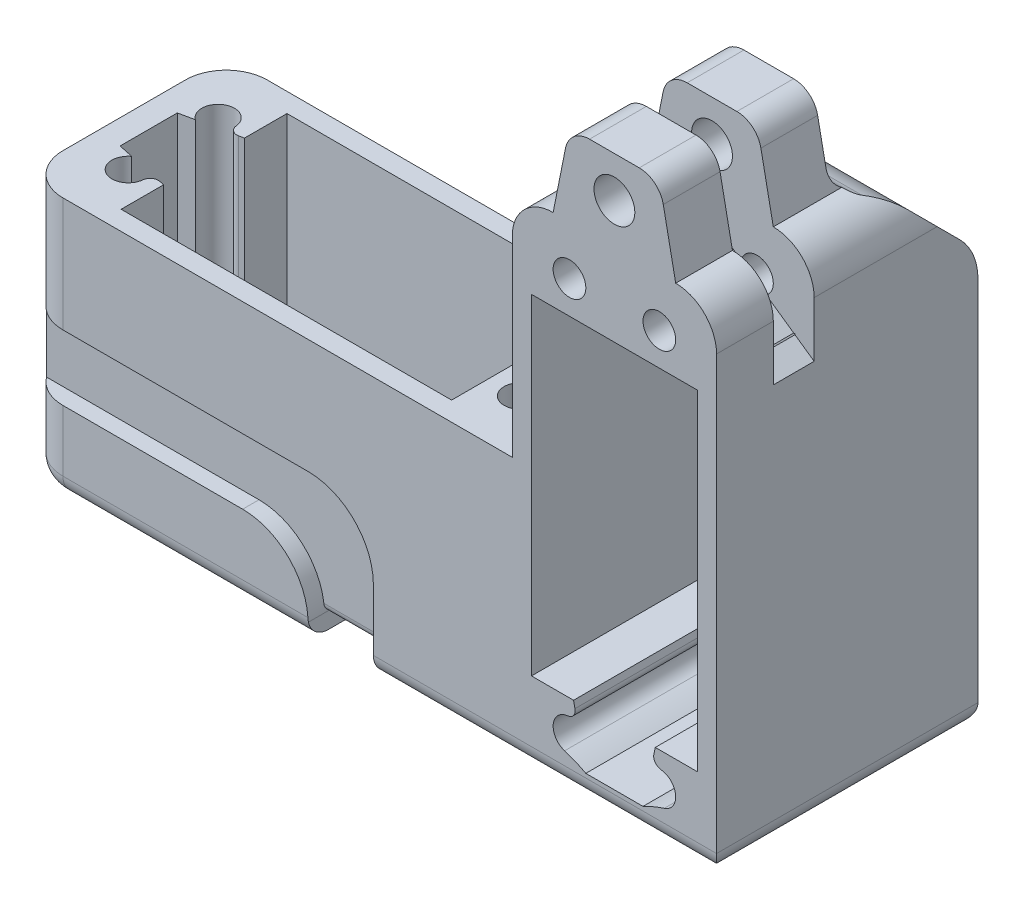
from build123d import *

# Parameters (mm, degrees)
CROQUIS3_R                 = 2.000000000000003
SALIENTE_EXTRUIR1_DEPTH    = 28
SALIENTE_EXTRUIR2_START    = -4
SALIENTE_EXTRUIR2_DEPTH    = 4
CORTAR_EXTRUIR1_DEPTH      = 23
REDONDEO12_R               = 1
CROQUIS5_W                 = 9.903571428571428
CROQUIS5_H                 = 4.000000000000001
CORTAR_EXTRUIR2_DEPTH      = 59.84556589072792
CROQUIS6_R                 = 8.125
CORTAR_EXTRUIR3_DEPTH      = 4
REDONDEO4_R                = 5
CROQUIS9_R                 = 2.000000000000001
CROQUIS9_R_2               = 2.0000000000000036
SALIENTE_EXTRUIR3_DEPTH    = 28
SALIENTE_EXTRUIR4_START    = -28
CROQUIS9_3_R               = 2.000000000000001
CROQUIS9_3_R_2             = 2.0000000000000036
SALIENTE_EXTRUIR4_DEPTH    = 4
CROQUIS10_R                = 8.124999999999998
CORTAR_EXTRUIR4_DEPTH      = 86.06234478310549
CORTAR_EXTRUIR5_DEPTH      = 23
REDONDEO10_R               = 15
REDONDEO11_R               = 1
CORTAR_EXTRUIR6_DEPTH      = 78.13917616879161
REDONDEO15_R               = 5
REDONDEO16_R               = 2.5
CORTAR_EXTRUIR7_DEPTH      = 2
CORTAR_EXTRUIR8_START      = 12.5
CORTAR_EXTRUIR8_DEPTH      = 2
REDONDEO17_R               = 1
REDONDEO18_R               = 8
REDONDEO19_R               = 2
CORTAR_EXTRUIR9_DEPTH      = 104.8838413994162
CORTAR_EXTRUIR9_DEPTH_BACK = 104.8838413994162
REDONDEO21_R               = 7.5
CROQUIS18_R                = 2.5000000000000027
SALIENTE_EXTRUIR5_DEPTH    = 18.893398
REDONDEO22_R               = 3
CORTAR_EXTRUIR10_DEPTH     = 2.5


# Some blends are built 0.0001 mm under size
with BuildPart() as part:
    # Croquis3 → Saliente-Extruir1 (new body)
    with BuildSketch(Plane(origin=(0, 0, 0), x_dir=(1, 0, 0), z_dir=(0, 1, 0))):
        with BuildLine():
            Line((-20.000000000000007, -12.499999999999998), (-25, -12.5))
            ThreePointArc((-25, -12.5), (-28.535533905932738, -11.035533905932738), (-30.000000000000007, -7.499999999999999))
            Line((-30.000000000000007, -7.499999999999999), (-30.000000000000007, 7.499999999999999))
            ThreePointArc((-30.000000000000007, 7.499999999999999), (-28.53553390593274, 11.035533905932741), (-25, 12.5))
            Line((-25, 12.5), (-20.000000000000004, 12.499999999999993))
            Line((-20.000000000000004, 12.499999999999993), (20.000000000000004, 12.499999999999993))
            Line((20.000000000000004, 12.499999999999993), (25, 12.5))
            Line((25, 12.5), (30.000000000000007, 12.499999999999998))
            Line((30.000000000000007, 12.499999999999998), (30.000000000000007, -12.499999999999998))
            Line((30.000000000000007, -12.499999999999998), (25, -12.5))
            Line((25, -12.5), (20.000000000000007, -12.499999999999998))
            Line((20.000000000000007, -12.499999999999998), (-20.000000000000007, -12.499999999999998))
        make_face()
        with Locations(Location((-24, 5.499999999999998, 0), (0, 0, 90))):
            Circle(CROQUIS3_R, mode=Mode.SUBTRACT)
        with Locations(Location((-24, -5.499999999999998, 0), (0, 0, 90))):
            Circle(CROQUIS3_R, mode=Mode.SUBTRACT)
        with Locations(Location((24, -5.499999999999998, 0), (0, 0, 90))):
            Circle(CROQUIS3_R, mode=Mode.SUBTRACT)
        with Locations(Location((24, 5.499999999999998, 0), (0, 0, 90))):
            Circle(CROQUIS3_R, mode=Mode.SUBTRACT)
        Polygon((-20.225, 10.149999999999999), (20.225, 10.149999999999999), (20.224999999999998, -10.149999999999999), (-20.224999999999998, -10.149999999999999), align=None, mode=Mode.SUBTRACT)
    extrude(amount=SALIENTE_EXTRUIR1_DEPTH)

    # Croquis3<2> → Saliente-Extruir2 (add)
    with BuildSketch(Plane(origin=(0, 0, 0), x_dir=(1, 0, 0), z_dir=(0, 1, 0)).offset(SALIENTE_EXTRUIR2_START)):
        with BuildLine():
            Line((-25, -12.5), (30.000000000000007, -12.499999999999998))
            Line((30.000000000000007, -12.499999999999998), (30.000000000000007, 12.499999999999998))
            Line((30.000000000000007, 12.499999999999998), (-25, 12.5))
            ThreePointArc((-25, 12.5), (-28.535533905932745, 11.03553390593274), (-30.000000000000007, 7.499999999999999))
            Line((-30.000000000000007, 7.499999999999999), (-30.000000000000007, -7.499999999999999))
            ThreePointArc((-30.000000000000007, -7.499999999999999), (-28.535533905932738, -11.035533905932738), (-25, -12.5))
        make_face()
    extrude(amount=SALIENTE_EXTRUIR2_DEPTH)

    # Croquis4 → Cortar-Extruir1 (cut)
    with BuildSketch(Plane(origin=(0, 27.999999999999915, 0), x_dir=(1, 0, 0), z_dir=(0, 1, 0))):
        Polygon((-20, 5), (-20, -5), (-27, -3.5), (-27, 3.5), align=None)
    extrude(amount=-CORTAR_EXTRUIR1_DEPTH, mode=Mode.SUBTRACT)

    # Redondeo12
    redondeo12_edges = [part.edges().sort_by_distance(p)[0] for p in [
        (-22.258829297566827, 16.499999999999936, 4.515965150521393),
        (-22.258829297566827, 16.499999999999936, -4.515965150521393),
    ]]
    fillet(redondeo12_edges, radius=REDONDEO12_R)

    # Croquis5 → Cortar-Extruir2 (cut, through all)
    with BuildSketch(Plane(origin=(-20.224999999999998, 0, 3.46e-15), x_dir=(0, 0, -1), z_dir=(1, 0, 0))):
        with Locations((4e-15, 7.000000000000002)):
            Rectangle(CROQUIS5_W, CROQUIS5_H)
    extrude(amount=-CORTAR_EXTRUIR2_DEPTH, mode=Mode.SUBTRACT)

    # Croquis6 → Cortar-Extruir3 (cut)
    with BuildSketch(Plane.XZ.offset(4)):
        with Locations(Location((-10.000000000000004, 0, 0), (0, 0, 270))):
            Circle(CROQUIS6_R)
    extrude(amount=-CORTAR_EXTRUIR3_DEPTH, mode=Mode.SUBTRACT)

    # Redondeo4
    # the kernel refuses this fillet: 5 mm, written as the material it takes off along each edge
    with BuildSketch(Plane(origin=(-27, 9.000000000000004, -16), x_dir=(0, 1, 0), z_dir=(0, 0, 1))) as redondeo4_piece_1_section:
        with BuildLine():
            CenterArc((REDONDEO4_R, REDONDEO4_R), REDONDEO4_R, 180, 90)
            Line((0, REDONDEO4_R), (0, 0))
            Line((0, 0), (REDONDEO4_R, 0))
        make_face()
    redondeo4_piece_1 = extrude(amount=32, mode=Mode.PRIVATE)
    redondeo4_piece_1 = split(redondeo4_piece_1, bisect_by=Plane(origin=(-28.726272929102212, 10.177130601266654, -3.13008437233524), z_dir=(0.20952908873087348, 0, 0.9778024140774095)), keep=Keep.TOP, mode=Mode.PRIVATE)
    redondeo4_piece_1 = split(redondeo4_piece_1, bisect_by=Plane(origin=(-28.726272929102194, 10.177130601266654, 3.1300843723352445), z_dir=(0.20952908873087348, 0, -0.9778024140774095)), keep=Keep.TOP, mode=Mode.PRIVATE)
    add(redondeo4_piece_1, mode=Mode.SUBTRACT)

    # Croquis9 → Saliente-Extruir3 (add)
    with BuildSketch(Plane(origin=(-8.729e-14, 0, 12.50000000000003), x_dir=(1.047e-14, 1, 0), z_dir=(-6.98e-15, 0, 1))):
        with BuildLine():
            Line((6.000000000000209, -54.999999999998195), (1.0000000000002063, -54.99999999999887))
            Line((1.0000000000002063, -54.99999999999887), (-3.9999999999997944, -54.999999999998536))
            Line((-3.9999999999997944, -54.999999999998536), (-3.9999999999998006, -49.99999999999853))
            Line((-3.9999999999998006, -49.99999999999853), (-3.9999999999998006, -35.00000000001323))
            Line((-3.9999999999998006, -35.00000000001323), (-3.9999999999997953, -29.999999999999616))
            Line((-3.9999999999997953, -29.999999999999616), (1.000000000013811, -29.999999999999616))
            Line((1.000000000013811, -29.999999999999616), (6.000000000000209, -29.999999999999954))
            Line((6.000000000000209, -29.999999999999954), (46.45000000000026, -29.999999999999954))
            Line((46.45000000000026, -29.999999999999954), (51.44999999998665, -29.999999999999623))
            ThreePointArc((51.44999999998665, -29.999999999999623), (54.98553390593301, -31.46446609406689), (56.45000000000027, -35.000000000013245))
            Line((56.45000000000027, -35.000000000013245), (56.45000000000027, -49.99999999999854))
            ThreePointArc((56.45000000000027, -49.99999999999854), (54.985533905933, -53.53553390593128), (51.450000000000266, -54.99999999999854))
            Line((51.450000000000266, -54.99999999999854), (46.45000000000026, -54.9999999999982))
            Line((46.45000000000026, -54.9999999999982), (6.000000000000209, -54.999999999998195))
        make_face()
        with Locations(Location((2.0000000000002047, -36.99999999999908, 0), (0, 0, 270))):
            Circle(CROQUIS9_R, mode=Mode.SUBTRACT)
        with Locations(Location((2.0000000000002083, -47.999999999999076, 0), (0, 0, 90))):
            Circle(CROQUIS9_R, mode=Mode.SUBTRACT)
        with Locations(Location((50.450000000000266, -47.999999999999076, 0), (0, 0, 270))):
            Circle(CROQUIS9_R_2, mode=Mode.SUBTRACT)
        with Locations(Location((50.450000000000266, -36.99999999999908, 0), (0, 0, 90))):
            Circle(CROQUIS9_R_2, mode=Mode.SUBTRACT)
        Polygon((6.000000000000209, -32.350000000005885), (46.45000000000026, -32.3500000000059), (46.45000000000026, -52.65000000000589), (6.000000000000209, -52.650000000005875), align=None, mode=Mode.SUBTRACT)
    extrude(amount=-SALIENTE_EXTRUIR3_DEPTH)

    # Croquis9<3> → Saliente-Extruir4 (add)
    # profile 1 of 6: a face of its own
    with BuildSketch(Plane(origin=(-8.729e-14, 0, 12.50000000000003), x_dir=(1.047e-14, 1, 0), z_dir=(-6.98e-15, 0, 1)).offset(SALIENTE_EXTRUIR4_START)):
        with BuildLine():
            Line((56.45000000000027, -49.99999999999854), (56.45000000000027, -35.000000000013245))
            ThreePointArc((56.45000000000027, -35.000000000013245), (54.98553390593301, -31.46446609406689), (51.44999999998665, -29.999999999999623))
            Line((51.44999999998665, -29.999999999999623), (46.45000000000026, -29.999999999999954))
            Line((46.45000000000026, -29.999999999999954), (6.000000000000209, -29.999999999999954))
            Line((6.000000000000209, -29.999999999999954), (1.000000000013811, -29.999999999999616))
            Line((1.000000000013811, -29.999999999999616), (-3.9999999999997953, -29.999999999999616))
            Line((-3.9999999999997953, -29.999999999999616), (-3.9999999999998006, -35.00000000001323))
            Line((-3.9999999999998006, -35.00000000001323), (-3.9999999999998006, -49.99999999999853))
            Line((-3.9999999999998006, -49.99999999999853), (-3.9999999999997944, -54.999999999998536))
            Line((-3.9999999999997944, -54.999999999998536), (1.0000000000002063, -54.99999999999887))
            Line((1.0000000000002063, -54.99999999999887), (6.000000000000209, -54.999999999998195))
            Line((6.000000000000209, -54.999999999998195), (46.45000000000026, -54.9999999999982))
            Line((46.45000000000026, -54.9999999999982), (51.450000000000266, -54.99999999999854))
            ThreePointArc((51.450000000000266, -54.99999999999854), (54.985533905933, -53.53553390593128), (56.45000000000027, -49.99999999999854))
        make_face()
        with Locations(Location((2.0000000000002047, -36.99999999999908, 0), (0, 0, 270))):
            Circle(CROQUIS9_3_R, mode=Mode.SUBTRACT)
        with Locations(Location((2.0000000000002083, -47.999999999999076, 0), (0, 0, 90))):
            Circle(CROQUIS9_3_R, mode=Mode.SUBTRACT)
        with Locations(Location((50.450000000000266, -47.999999999999076, 0), (0, 0, 270))):
            Circle(CROQUIS9_3_R_2, mode=Mode.SUBTRACT)
        with Locations(Location((50.450000000000266, -36.99999999999908, 0), (0, 0, 90))):
            Circle(CROQUIS9_3_R_2, mode=Mode.SUBTRACT)
        Polygon((6.000000000000209, -32.350000000005885), (46.45000000000026, -32.3500000000059), (46.45000000000026, -52.65000000000589), (6.000000000000209, -52.650000000005875), align=None, mode=Mode.SUBTRACT)
    # profile 2 of 6: a face of its own
    with BuildSketch(Plane(origin=(-8.729e-14, 0, 12.50000000000003), x_dir=(1.047e-14, 1, 0), z_dir=(-6.98e-15, 0, 1)).offset(SALIENTE_EXTRUIR4_START)):
        Polygon((46.45000000000026, -32.3500000000059), (46.45000000000026, -52.65000000000589), (6.000000000000209, -52.650000000005875), (6.000000000000209, -32.350000000005885), align=None)
    # profile 3 of 6: a face of its own
    with BuildSketch(Plane(origin=(-8.729e-14, 0, 12.50000000000003), x_dir=(1.047e-14, 1, 0), z_dir=(-6.98e-15, 0, 1)).offset(SALIENTE_EXTRUIR4_START)):
        with Locations(Location((50.450000000000266, -36.99999999999908, 0), (0, 0, 90))):
            Circle(CROQUIS9_3_R_2)
    # profile 4 of 6: a face of its own
    with BuildSketch(Plane(origin=(-8.729e-14, 0, 12.50000000000003), x_dir=(1.047e-14, 1, 0), z_dir=(-6.98e-15, 0, 1)).offset(SALIENTE_EXTRUIR4_START)):
        with Locations(Location((50.450000000000266, -47.999999999999076, 0), (0, 0, 270))):
            Circle(CROQUIS9_3_R_2)
    # profile 5 of 6: a face of its own
    with BuildSketch(Plane(origin=(-8.729e-14, 0, 12.50000000000003), x_dir=(1.047e-14, 1, 0), z_dir=(-6.98e-15, 0, 1)).offset(SALIENTE_EXTRUIR4_START)):
        with Locations(Location((2.0000000000002047, -36.99999999999908, 0), (0, 0, 270))):
            Circle(CROQUIS9_3_R)
    # profile 6 of 6: a face of its own
    with BuildSketch(Plane(origin=(-8.729e-14, 0, 12.50000000000003), x_dir=(1.047e-14, 1, 0), z_dir=(-6.98e-15, 0, 1)).offset(SALIENTE_EXTRUIR4_START)):
        with Locations(Location((2.0000000000002083, -47.999999999999076, 0), (0, 0, 90))):
            Circle(CROQUIS9_3_R)
    extrude(amount=-SALIENTE_EXTRUIR4_DEPTH)

    # Croquis10 → Cortar-Extruir4 (cut, through all)
    with BuildSketch(Plane(origin=(1.3617e-13, 0, -19.49999999999997), x_dir=(-1, 0, -6.98e-15), z_dir=(6.98e-15, 0, -1))):
        with Locations((-42.500000000006416, 15.999999999999952)):
            Circle(CROQUIS10_R)
    extrude(amount=-CORTAR_EXTRUIR4_DEPTH, mode=Mode.SUBTRACT)

    # Croquis12 → Cortar-Extruir5 (cut)
    with BuildSketch(Plane.XY.offset(12.499999999999993)):
        Polygon((47.50000000000585, 5.999999999999869), (37.500000000005855, 5.999999999999869), (39.00000000000584, -1.000000000000132), (46.00000000000585, -1.000000000000132), align=None)
    extrude(amount=-CORTAR_EXTRUIR5_DEPTH, mode=Mode.SUBTRACT)

    # Redondeo10
    # the kernel refuses this fillet: 15 mm, written as the material it takes off along each edge
    with BuildSketch(Plane(origin=(38.61108710174538, 0.8149268585494547, -10.500000000000009), x_dir=(-0.9503416904758195, -0.3112084050014742, -6.636200555641898e-15), z_dir=(-6.98e-15, 0, 1))) as redondeo10_piece_1:
        with BuildLine():
            CenterArc((11.041645917355968, 12.207061948772331), REDONDEO10_R, 223.6893927384056, 10.779895272228202)
            Line((0.1952203516628514, 1.8458336215961186), (-0.02170815965101184, 1.6386090550525947))
            ThreePointArc((-0.02170815965101184, 1.6386090550525947), (-0.20072590796379902, 0.9544696411890312), (-0.2983360837953008, 0.03155283039097942))
            Line((-0.2983360837953008, 0.03155283039097942), (0.17434177764246475, -0.24414123897544637))
            ThreePointArc((0.17434177764246475, -0.24414123897544637), (1.1622785176164245, 0.0723917401636885), (2.150215257590374, -0.2441412389754458))
            Line((2.150215257590374, -0.2441412389754458), (2.3245570352328393, 3e-17))
        make_face()
    extrude(amount=28.811392588082185, mode=Mode.SUBTRACT)
    with BuildSketch(Plane(origin=(46.38891289826354, 0.8149268585349787, -10.500000000000005), x_dir=(-0.20952908873095713, -0.9778024140773917, -1.4631338064978176e-15), z_dir=(-6.98e-15, 0, 1))) as redondeo10_piece_2:
        with BuildLine():
            CenterArc((13.300674124340944, 9.696513488005287), REDONDEO10_R, 209.49339938846634, 10.779895272195745)
            Line((0.24448784620891684, 2.3116641414906947), (-0.01663587935372404, 2.1639671545604053))
            ThreePointArc((-0.01663587935372404, 2.1639671545604053), (0.19423415063235164, 1.1482181897491972), (-0.22445054863130426, 0.19905263429331416))
            Line((-0.22445054863130426, 0.19905263429331416), (2.518e-14, -0.29999999999999793))
            ThreePointArc((2.518e-14, -0.29999999999999793), (0.9280642144086119, -0.30000000000007826), (1.6272375149067015, -0.19393026976010264))
            Line((1.6272375149067015, -0.19393026976010264), (1.8561284288171775, -2e-17))
        make_face()
    extrude(amount=28.811392588053984, mode=Mode.SUBTRACT)

    # Redondeo11
    redondeo11_edges = [part.edges().sort_by_distance(p)[0] for p in [
        (47.01596515052823, 3.7411707024372527, 1.0000000000000835),
        (37.9840348494855, 3.7411707024285876, 1.0000000000000693),
    ]]
    fillet(redondeo11_edges, radius=REDONDEO11_R)

    # Croquis13 → Cortar-Extruir6 (cut, through all)
    with BuildSketch(Plane(origin=(6.281e-14, 6.000000000000208, 0), x_dir=(1, -1.047e-14, 0), z_dir=(1.047e-14, 1, 0))):
        Polygon((37.50000000000579, 10.499999999999673), (47.50000000000579, 10.499999999999638), (47.50000000000579, 6.499999999999638), (37.50000000000579, 6.499999999999637), align=None)
    extrude(amount=-CORTAR_EXTRUIR6_DEPTH, mode=Mode.SUBTRACT)

    # Redondeo15
    redondeo15_edges = [part.edges().sort_by_distance(p)[0] for p in [
        (30.000000000000007, 12, -12.499999999999998),
    ]]
    fillet(redondeo15_edges, radius=REDONDEO15_R)

    # Redondeo16
    # the kernel refuses this fillet: 2.5 mm, written as the material it takes off along each edge
    with BuildSketch(Plane(origin=(-25, -4, 12.5), x_dir=(4.63e-15, 1, 0), z_dir=(1, -4.63e-15, 5.17e-15))) as redondeo16_piece_1:
        with BuildLine():
            CenterArc((REDONDEO16_R, -REDONDEO16_R), REDONDEO16_R, 90, 90)
            Line((0, -REDONDEO16_R), (0, 0))
            Line((0, 0), (REDONDEO16_R, 0))
        make_face()
    extrude(amount=86.24999999999841, mode=Mode.SUBTRACT)
    with BuildSketch(Plane(origin=(-24.999999999999993, -4, 7.4999999999999885), x_dir=(-1, 0, 2.13e-15), z_dir=(-2.13e-15, 0, -1))) as redondeo16_piece_2:
        with BuildLine():
            CenterArc((5.000000000000014 - REDONDEO16_R, REDONDEO16_R), REDONDEO16_R, 270, 90)
            Line((5.000000000000014 - REDONDEO16_R, 0), (5.000000000000014, 0))
            Line((5.000000000000014, 0), (5.000000000000014, REDONDEO16_R))
        make_face()
    revolve(axis=Axis((-24.999999999999993, -4, 7.4999999999999885), (0, 1, 0)), revolution_arc=89.9999999999998, mode=Mode.SUBTRACT)
    with BuildSketch(Plane(origin=(-30.000000000000007, -4, -7.499999999999999), x_dir=(0, 1, 0), z_dir=(0, 0, 1))) as redondeo16_piece_3:
        with BuildLine():
            CenterArc((REDONDEO16_R, -REDONDEO16_R), REDONDEO16_R, 90, 90)
            Line((0, -REDONDEO16_R), (0, 0))
            Line((0, 0), (REDONDEO16_R, 0))
        make_face()
    extrude(amount=14.999999999999998, mode=Mode.SUBTRACT)
    with BuildSketch(Plane(origin=(-25.000000000000007, -4, -7.500000000000002), x_dir=(1.42e-15, 0, -1), z_dir=(1, 0, 1.42e-15))) as redondeo16_piece_4:
        with BuildLine():
            CenterArc((4.999999999999998 - REDONDEO16_R, REDONDEO16_R), REDONDEO16_R, 270, 90)
            Line((4.999999999999998 - REDONDEO16_R, 0), (4.999999999999998, 0))
            Line((4.999999999999998, 0), (4.999999999999998, REDONDEO16_R))
        make_face()
    revolve(axis=Axis((-25.000000000000007, -4, -7.500000000000002), (0, 1, 0)), revolution_arc=90.00000000000011, mode=Mode.SUBTRACT)
    with BuildSketch(Plane(origin=(24.999999999999694, -4, -17.49999999999993), x_dir=(1, 0, 7.11e-15), z_dir=(7.11e-15, 0, -1))) as redondeo16_piece_5:
        with BuildLine():
            CenterArc((5 + REDONDEO16_R, -REDONDEO16_R), REDONDEO16_R, 90, 90)
            Line((5 + REDONDEO16_R, 0), (5, 0))
            Line((5, 0), (5, -REDONDEO16_R))
        make_face()
    revolve(axis=Axis((24.999999999999694, -4, -17.49999999999993), (0, -1, 0)), revolution_arc=89.99999999999969, mode=Mode.SUBTRACT)
    with BuildSketch(Plane(origin=(54.999999999994905, -4, -25.74999999999909), x_dir=(7.674e-14, 1, 0), z_dir=(-6.88e-15, 0, 1))) as redondeo16_piece_6:
        with BuildLine():
            CenterArc((REDONDEO16_R, REDONDEO16_R), REDONDEO16_R, 180.00000000000455, 89.99999999999534)
            Line((-1.9362e-13, REDONDEO16_R), (0, 0))
            Line((0, 0), (REDONDEO16_R, 0))
        make_face()
    extrude(amount=44.499999999999005, mode=Mode.SUBTRACT)
    with BuildSketch(Plane(origin=(23.749999999999705, -4, -19.499999999999805), x_dir=(1.044e-14, 1, 0), z_dir=(1, -1.044e-14, 6.96e-15))) as redondeo16_piece_7:
        with BuildLine():
            CenterArc((REDONDEO16_R, REDONDEO16_R), REDONDEO16_R, 180, 90)
            Line((0, REDONDEO16_R), (0, 0))
            Line((0, 0), (REDONDEO16_R, 0))
        make_face()
    extrude(amount=37.499999999998934, mode=Mode.SUBTRACT)
    with BuildSketch(Plane(origin=(24.999999999999687, -4, -12.499999999999998), x_dir=(0, 1, 2.771e-14), z_dir=(-1, 0, -3e-17))) as redondeo16_piece_8:
        with BuildLine():
            CenterArc((REDONDEO16_R, -REDONDEO16_R), REDONDEO16_R, 90.00000000000159, 89.99999999999841)
            Line((6.928e-14, -REDONDEO16_R), (0, 0))
            Line((0, 0), (REDONDEO16_R, 0))
        make_face()
    extrude(amount=49.99999999999969, mode=Mode.SUBTRACT)
    with BuildSketch(Plane(origin=(29.99999999999975, -4, -25.74999999999983), x_dir=(1.137e-14, 1, -1.561e-14), z_dir=(4.263e-14, 1.561e-14, 1))) as redondeo16_piece_9:
        with BuildLine():
            CenterArc((REDONDEO16_R, -REDONDEO16_R), REDONDEO16_R, 90.00000000000006, 90.00000000000057)
            Line((2.842e-14, -REDONDEO16_R), (0, 0))
            Line((0, 0), (REDONDEO16_R, 0))
        make_face()
    extrude(amount=8.24999999999994, mode=Mode.SUBTRACT)

    # Croquis14 → Cortar-Extruir7 (cut)
    with BuildSketch(Plane.XZ.offset(4)):
        Polygon((47.50000000000585, -6.499999999999638), (47.50000000000584, 5.500000000000363), (13.000000000000002, 5.500000000000363), (13.000000000000002, 12.499999999999998), (5.000000000000001, 12.499999999999998), (4.999999999999997, -2.499999999999641), (37.50000000000575, -2.499999999999637), (37.50000000000575, -6.499999999999637), align=None)
    extrude(amount=-CORTAR_EXTRUIR7_DEPTH, mode=Mode.SUBTRACT)

    # Croquis15 → Cortar-Extruir8 (cut)
    with BuildSketch(Plane.XY.offset(CORTAR_EXTRUIR8_START)):
        Polygon((4.999999999999997, -4), (4.999999999999997, 6), (-30, 5.999999999999995), (-30, 13.999999999999996), (13.000000000000002, 14.000000000000002), (13.000000000000002, -4), align=None)
    extrude(amount=-CORTAR_EXTRUIR8_DEPTH, mode=Mode.SUBTRACT)

    # Redondeo17
    redondeo17_edges = [part.edges().sort_by_distance(p)[0] for p in [
        (9, -2, 10.5),
    ]]
    fillet(redondeo17_edges, radius=REDONDEO17_R)

    # Redondeo18
    redondeo18_edges = [part.edges().sort_by_distance(p)[0] for p in [
        (47.50000000000584, -3, 5.500000000000363),
        (37.50000000000575, -3, -2.499999999999637),
        (4.999999999999997, -3, -2.499999999999641),
        (4.999999999999997, 6, 11.5),
        (13.000000000000002, 14.000000000000002, 11.5),
    ]]
    fillet(redondeo18_edges, radius=REDONDEO18_R - 0.0001)  # a hair under: the kernel refuses the full size

    # Redondeo19
    redondeo19_edges = [part.edges().sort_by_distance(p)[0] for p in [
        (13.000000000000002, -3, 5.500000000000363),
    ]]
    fillet(redondeo19_edges, radius=REDONDEO19_R)

    # Croquis17 → Cortar-Extruir9 (cut, two sides: drawn at the far end of the back side and taken through both)
    with BuildSketch(Plane(origin=(54.999999999999, 6.8695e-12, 3.8406e-13), x_dir=(6.98e-15, 0, -1), z_dir=(1, 1.249e-13, 6.98e-15)).offset(-CORTAR_EXTRUIR9_DEPTH_BACK)):
        Polygon((19.49999999999997, 56.44999999999351), (19.49999999999997, 46.4499999999935), (9.49999999999997, 56.44999999999351), align=None)
    extrude(amount=CORTAR_EXTRUIR9_DEPTH + CORTAR_EXTRUIR9_DEPTH_BACK, mode=Mode.SUBTRACT)

    # Redondeo21
    # the kernel refuses this fillet: 7.5 mm, written as the material it takes off along each edge
    with BuildSketch(Plane(origin=(62.76650429449471, 46.450000000001346, -19.49999999999953), x_dir=(1.2489e-13, -1, 0), z_dir=(-1, -1.2489e-13, -6.98e-15))) as redondeo21_piece_1:
        with BuildLine():
            CenterArc((REDONDEO21_R * 0.414213562373, REDONDEO21_R), REDONDEO21_R, 225, 45)
            Line((-REDONDEO21_R * 0.292893218813, REDONDEO21_R * 0.292893218813), (0, 0))
            Line((0, 0), (REDONDEO21_R * 0.414213562373, 0))
        make_face()
    extrude(amount=40.53300858898997, mode=Mode.SUBTRACT)
    with BuildSketch(Plane(origin=(27.233495705518365, 56.44999999999998, -9.499999999996708), x_dir=(-6.99e-15, 0, 1), z_dir=(1, 1.2489e-13, 6.99e-15))) as redondeo21_piece_2:
        with BuildLine():
            CenterArc((REDONDEO21_R * 0.414213562373, REDONDEO21_R), REDONDEO21_R, 225, 45)
            Line((-REDONDEO21_R * 0.292893218813, REDONDEO21_R * 0.292893218813), (0, 0))
            Line((0, 0), (REDONDEO21_R * 0.414213562373, 0))
        make_face()
    extrude(amount=30.533008588976372, mode=Mode.SUBTRACT)

    # Croquis18 → Saliente-Extruir5 (add)
    with BuildSketch(Plane.XY.offset(12.499999999999993)):
        Polygon((49.99999999999904, 56.44999999999975), (35.000000000013735, 56.4499999999999), (37.00000000000639, 66.4499999999999), (48.00000000000639, 66.4499999999999), align=None)
        with Locations((42.50000000000639, 61.4499999999999)):
            Circle(CROQUIS18_R, mode=Mode.SUBTRACT)
    extrude(amount=-SALIENTE_EXTRUIR5_DEPTH)

    # Redondeo22
    redondeo22_edges = [part.edges().sort_by_distance(p)[0] for p in [
        (42.50000000000652, 56.45, -6.393398282199501),
        (37.000000000006395, 66.4499999999999, 3.0533009999999923),
        (48.000000000006395, 66.4499999999999, 3.0533009999999923),
    ]]
    fillet(redondeo22_edges, radius=REDONDEO22_R)

    # Croquis19 → Cortar-Extruir10 (cut, symmetric)
    with BuildSketch(Plane.XY.offset(3.053300858899294)):
        with BuildLine():
            Line((54.999999999999105, 44.69740577238354), (54.999999999999105, 69.4499999999999))
            Line((54.999999999999105, 69.4499999999999), (42.500000000006395, 69.4499999999999))
            ThreePointArc((42.500000000006395, 69.4499999999999), (34.500000000006395, 61.4499999999999), (42.500000000006395, 53.4499999999999))
            Line((42.500000000006395, 53.4499999999999), (54.999999999999105, 44.69740577238354))
        make_face()
    extrude(amount=CORTAR_EXTRUIR10_DEPTH, both=True, mode=Mode.SUBTRACT)


solid = part.part
